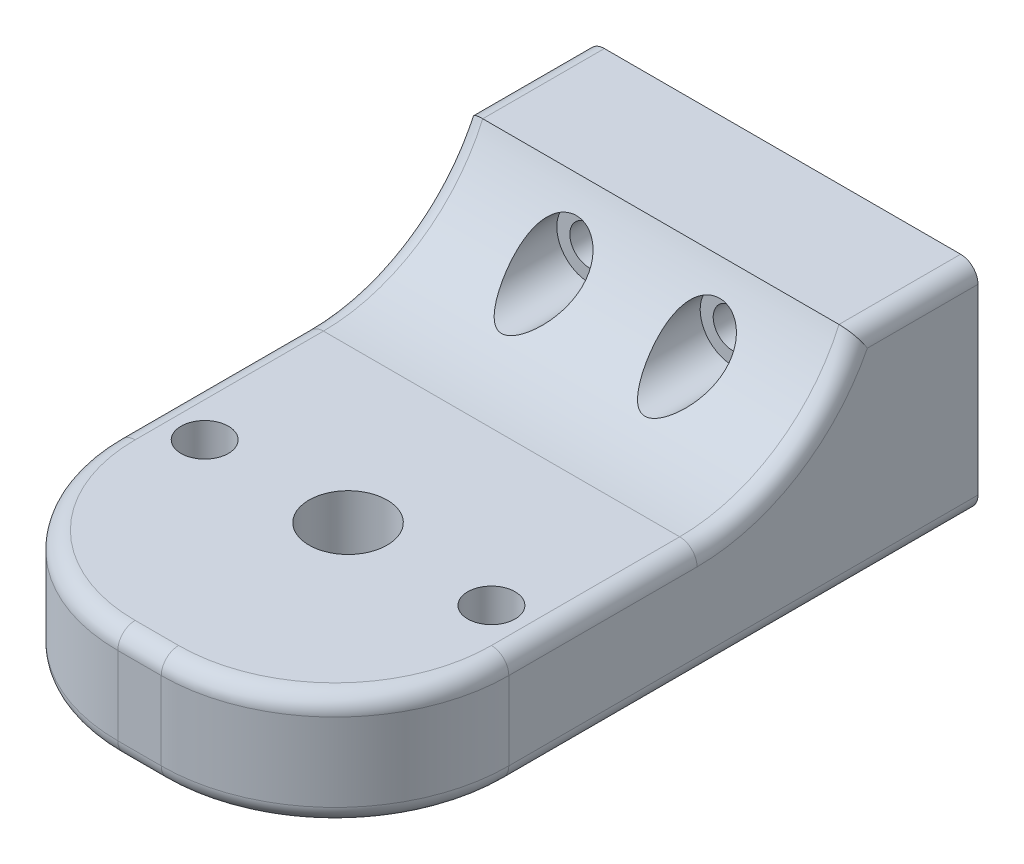
from build123d import *

# Parameters (mm, degrees)
SKETCH1_W           = 45
SKETCH1_H           = 25
SKETCH1_R           = 2.225
BOSS_EXTRUDE1_DEPTH = 74
SKETCH2_R           = 4.5
SKETCH2_R_2         = 2.725
CUT_EXTRUDE1_DEPTH  = 82.284992465
SKETCH3_W           = 45
SKETCH3_H           = 12
CUT_EXTRUDE2_DEPTH  = 60
FILLET4_R           = 20
SKETCH4_R           = 3.725
CUT_EXTRUDE4_DEPTH  = 27
FILLET5_R           = 20
FILLET6_R           = 2


with BuildPart() as part:
    # Sketch1 → Boss-Extrude1 (new body)
    with BuildSketch(Plane.XY):
        Rectangle(SKETCH1_W, SKETCH1_H)
        with Locations((-8.25, 6)):
            Circle(SKETCH1_R, mode=Mode.SUBTRACT)
        with Locations((8.25, 6)):
            Circle(SKETCH1_R, mode=Mode.SUBTRACT)
    extrude(amount=BOSS_EXTRUDE1_DEPTH)

    # Sketch2 → Cut-Extrude1 (cut, through all)
    with BuildSketch(Plane.XZ.offset(12.5)):
        with Locations(Location((0, 50, 0), (0, 0, 270))):
            Circle(SKETCH2_R)
        with Locations(Location((-16.5, 50, 0), (0, 0, 270))):
            Circle(SKETCH2_R_2)
        with Locations(Location((16.5, 50, 0), (0, 0, 270))):
            Circle(SKETCH2_R_2)
    extrude(amount=-CUT_EXTRUDE1_DEPTH, mode=Mode.SUBTRACT)

    # Sketch3 → Cut-Extrude2 (cut)
    with BuildSketch(Plane.XY.offset(74)):
        with Locations((0, 6.5)):
            Rectangle(SKETCH3_W, SKETCH3_H)
    extrude(amount=-CUT_EXTRUDE2_DEPTH, mode=Mode.SUBTRACT)

    # Fillet4
    # the kernel refuses this fillet: 20 mm, written as the material it adds along each edge
    with BuildSketch(Plane(origin=(22.5, 0.5, 14), x_dir=(0, 1, 0), z_dir=(-1, 0, 0))) as fillet4_piece_1_section:
        with BuildLine():
            CenterArc((20, -18.33030278), FILLET4_R, 113.578178478, 66.421821522)
            Line((0, -18.33030278), (-0.4, -18.33030278))
            Line((-0.4, -18.33030278), (-0.4, 0))
            Line((-0.4, 0), (0, 0.4))
            ThreePointArc((0, 0.4), (6, 0.4), (11.84, 0.366606056))
            Line((11.84, 0.366606056), (12, 0))
        make_face()
    fillet4_piece_1 = extrude(amount=45, mode=Mode.PRIVATE)
    fillet4_piece_1 = fillet4_piece_1 - Plane(origin=(8.25, 6, 18.573304712), x_dir=(1, 0, 0), z_dir=(0, 0, -1)) * Cylinder(2.225, 164, mode=Mode.PRIVATE)
    fillet4_piece_1 = fillet4_piece_1 - Plane(origin=(-8.25, 6, 18.573304712), x_dir=(1, 0, 0), z_dir=(0, 0, -1)) * Cylinder(2.225, 164, mode=Mode.PRIVATE)
    add(fillet4_piece_1)

    # Sketch4 → Cut-Extrude4 (cut)
    with BuildSketch(Plane.XY.offset(14)):
        with Locations(Location((-8.25, 6, 0), (0, 0, 180))):
            Circle(SKETCH4_R)
        with Locations(Location((8.25, 6, 0), (0, 0, 180))):
            Circle(SKETCH4_R)
    extrude(amount=CUT_EXTRUDE4_DEPTH, mode=Mode.SUBTRACT)

    # Fillet5
    fillet5_edges = [part.edges().sort_by_distance(p)[0] for p in [
        (-22.5, -6, 74),
        (22.5, -6, 74),
    ]]
    fillet(fillet5_edges, radius=FILLET5_R)

    # Fillet6
    fillet6_edges = [part.edges().sort_by_distance(p)[0] for p in [
        (-22.5, 12.5, 7),
        (22.5, 12.5, 7),
        (22.5, 0.5, 43.16515139),
        (-22.5, 0.5, 43.16515139),
        (22.5, 3.766799469, 21.37585163),
        (-22.5, 3.766799469, 21.37585163),
        (0, 0.5, 74),
        (0, -12.5, 74),
        (-16.642135624, 0.5, 68.142135624),
        (16.642135624, 0.5, 68.142135624),
        (22.5, -12.5, 27),
        (-22.5, -12.5, 27),
        (-16.642135624, -12.5, 68.142135624),
        (16.642135624, -12.5, 68.142135624),
    ]]
    fillet(fillet6_edges, radius=FILLET6_R)


solid = part.part
